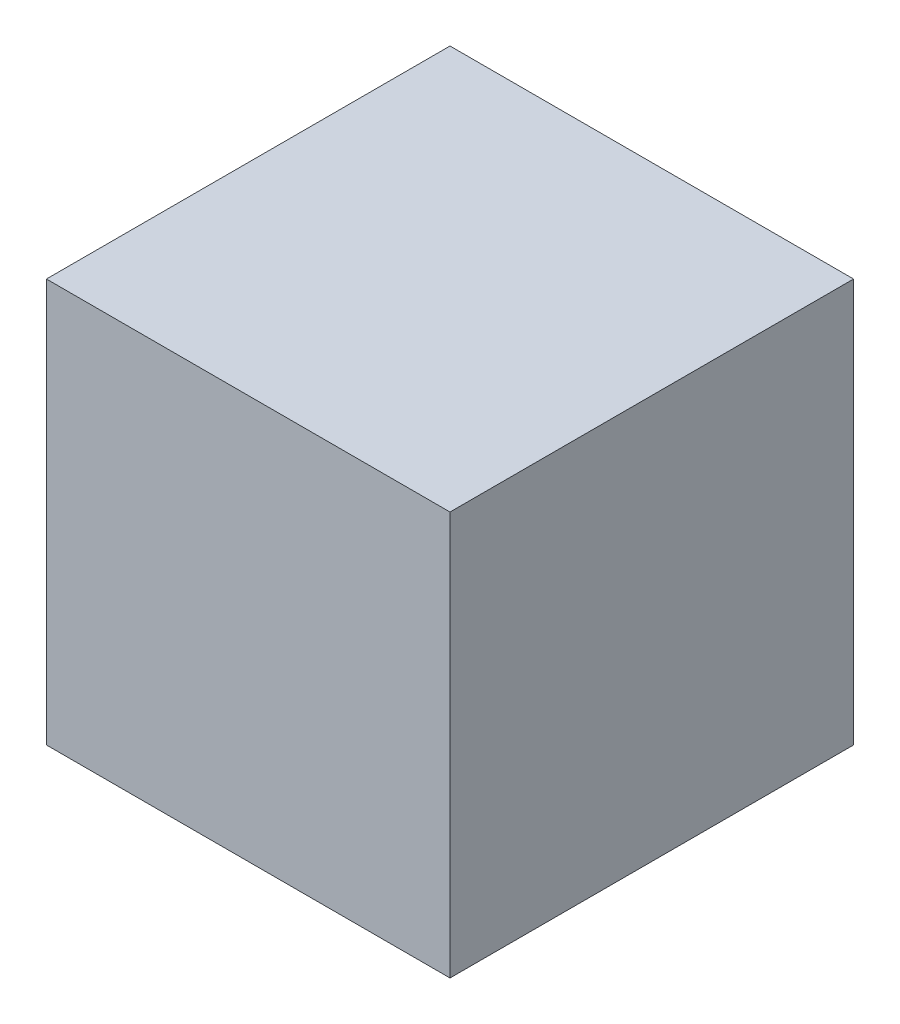
from build123d import *

# Parameters (mm, degrees)
SKETCH1_W           = 160.02
SKETCH1_H           = 160.02
BOSS_EXTRUDE1_DEPTH = 80.01


with BuildPart() as part:
    # Sketch1 → Boss-Extrude1 (new, symmetric)
    with BuildSketch(Plane(origin=(0, 0, 0), x_dir=(0, 0, -1), z_dir=(1, 0, 0))):
        Rectangle(SKETCH1_W, SKETCH1_H)
    extrude(amount=BOSS_EXTRUDE1_DEPTH, both=True)


solid = part.part
